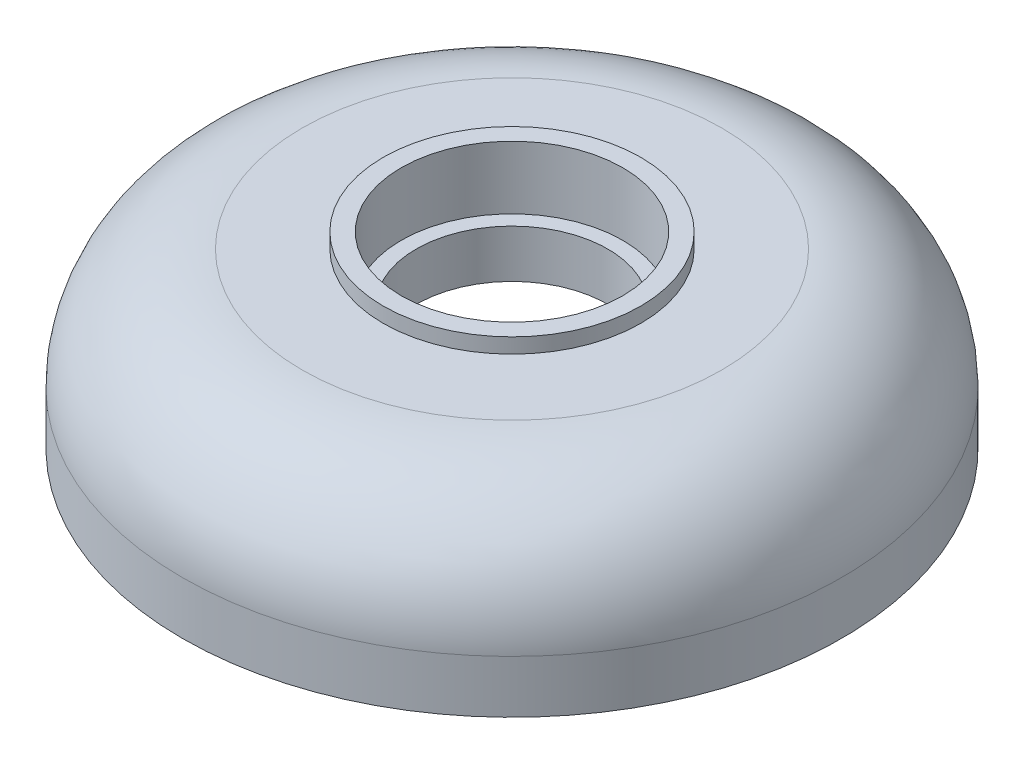
from build123d import *


with BuildPart() as part:
    # Sketch1 → Revolve1 (revolve)
    with BuildSketch(Plane.XY):
        with BuildLine():
            Line((-55, 10.20424121), (-45, 10.20424121))
            Line((-45, 10.20424121), (-45, 13.691019404))
            ThreePointArc((-45, 13.691019404), (-43.830222216, 16.904957452), (-40.868240888, 18.615058169))
            Line((-40.868240888, 18.615058169), (-16, 23))
            Line((-16, 23), (-16, 31))
            Line((-16, 31), (-18.5, 31))
            Line((-18.5, 31), (-18.5, 41.5))
            Line((-18.5, 41.5), (-21.5, 41.5))
            Line((-21.5, 41.5), (-21.5, 39))
            Line((-21.5, 39), (-35, 39))
            ThreePointArc((-35, 39), (-49.142135624, 33.142135624), (-55, 19))
            Line((-55, 19), (-55, 10.20424121))
        make_face()
    revolve(axis=Axis((0, 95.786399453, 0), (0, -1, 0)))


solid = part.part
